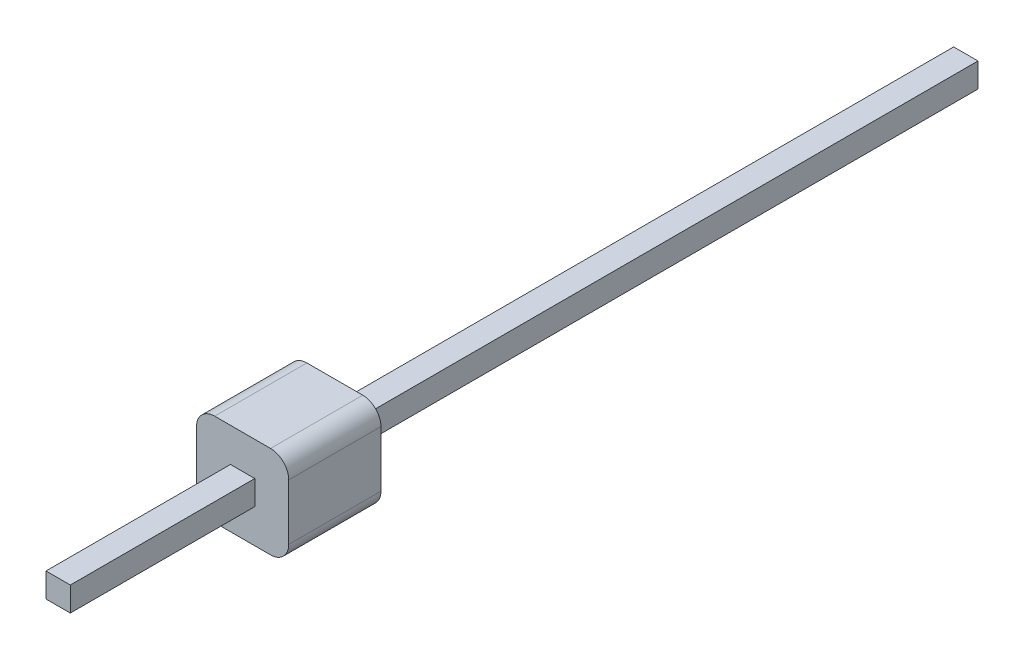
from build123d import *

# Parameters (mm, degrees)
SKETCH_1_W      = 2.54
SKETCH_1_H      = 2.54
EXTRUDE_1_DEPTH = 2.54
SKETCH_2_W      = 0.67
SKETCH_2_H      = 0.67
FILLET_1_R      = 0.5


with BuildPart() as part:
    # 草图1 → 拉伸1 (new body)
    with BuildSketch(Plane.XY):
        with Locations((0, -1.289090726)):
            Rectangle(SKETCH_1_W, SKETCH_1_H)
    extrude(amount=EXTRUDE_1_DEPTH)

    # 扫描1: sweep along a path in 草图3
    with BuildLine(Plane(origin=(0, 0, 0), x_dir=(0, 0, -1), z_dir=(1, 0, 0))) as sweep_1_path:
        Line((17.38, -1.299090726), (-7.62, -1.299090726))
    # 草图2 → 扫描1 (sweep)
    with BuildSketch(Plane(origin=(0, 0, 7.62), x_dir=(-1, 0, 0), z_dir=(0, 0, -1))):
        with Locations((0, -1.289090726)):
            Rectangle(SKETCH_2_W, SKETCH_2_H)
    sweep(path=sweep_1_path.line)

    # 圆角1
    fillet_1_edges = [part.edges().sort_by_distance(p)[0] for p in [
        (1.27, -0.019090726, 1.27),
        (1.27, -2.559090726, 1.27),
        (-1.27, -2.559090726, 1.27),
        (-1.27, -0.019090726, 1.27),
    ]]
    fillet(fillet_1_edges, radius=FILLET_1_R)


solid = part.part
